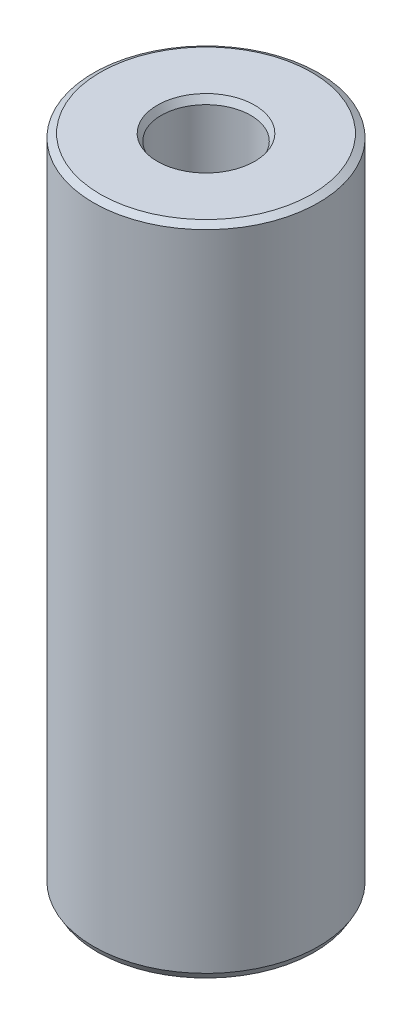
from build123d import *
from OCP.BRepFilletAPI import BRepFilletAPI_MakeChamfer

# Parameters (mm, degrees)
SKETCH1_R           = 47.5
BOSS_EXTRUDE1_DEPTH = 276.476043293
SKETCH2_R           = 18.899776633
CUT_EXTRUDE1_DEPTH  = 285.519775262
CHAMFER1_SIZE       = 1.662625285
CHAMFER1_SIZE2      = 2.879751468


with BuildPart() as part:
    # Sketch1 → Boss-Extrude1 (new body)
    with BuildSketch(Plane(origin=(0, 0, 0), x_dir=(1, 0, 0), z_dir=(0, 1, 0))):
        Circle(SKETCH1_R)
    extrude(amount=BOSS_EXTRUDE1_DEPTH)

    # Sketch2 → Cut-Extrude1 (cut, through all)
    with BuildSketch(Plane(origin=(0, 0, 0), x_dir=(1, 0, 0), z_dir=(0, 1, 0))):
        Circle(SKETCH2_R)
    extrude(amount=CUT_EXTRUDE1_DEPTH, mode=Mode.SUBTRACT)

    # Chamfer1: one chamfer whose edges measure the first distance from different faces: ONE call of the kernel's chamfer builder (chamfer() names one face for all edges)
    chamfer1_edges_1 = [part.edges().sort_by_distance(p)[0] for p in [
        (-18.899776633, 276.476043293, 0),
    ]]
    chamfer1_side_1 = [part.faces().sort_by_distance(p)[0] for p in [
        (-46.156497116, 276.476043293, 0),
    ]]
    chamfer1_edges_2 = [part.edges().sort_by_distance(p)[0] for p in [
        (-18.899776633, 0, 0),
    ]]
    chamfer1_side_2 = [part.faces().sort_by_distance(p)[0] for p in [
        (-18.899776633, 138.238021646, 0),
    ]]
    chamfer1_edges_3 = [part.edges().sort_by_distance(p)[0] for p in [
        (-47.5, 0, 0),
    ]]
    chamfer1_side_3 = [part.faces().sort_by_distance(p)[0] for p in [
        (-46.156497116, 0, 0),
    ]]
    chamfer1_edges_4 = [part.edges().sort_by_distance(p)[0] for p in [
        (-47.5, 276.476043293, 0),
    ]]
    chamfer1_side_4 = [part.faces().sort_by_distance(p)[0] for p in [
        (-47.5, 138.238021646, 0),
    ]]
    chamfer1 = BRepFilletAPI_MakeChamfer(part.part.solid().wrapped)
    for e in chamfer1_edges_1:
        chamfer1.Add(CHAMFER1_SIZE, CHAMFER1_SIZE2, e.wrapped, chamfer1_side_1[0].wrapped)  # the first distance lies on this face
    for e in chamfer1_edges_2:
        chamfer1.Add(CHAMFER1_SIZE, CHAMFER1_SIZE2, e.wrapped, chamfer1_side_2[0].wrapped)  # the first distance lies on this face
    for e in chamfer1_edges_3:
        chamfer1.Add(CHAMFER1_SIZE, CHAMFER1_SIZE2, e.wrapped, chamfer1_side_3[0].wrapped)  # the first distance lies on this face
    for e in chamfer1_edges_4:
        chamfer1.Add(CHAMFER1_SIZE, CHAMFER1_SIZE2, e.wrapped, chamfer1_side_4[0].wrapped)  # the first distance lies on this face
    add(Compound.cast(chamfer1.Shape()), mode=Mode.REPLACE)


solid = part.part
